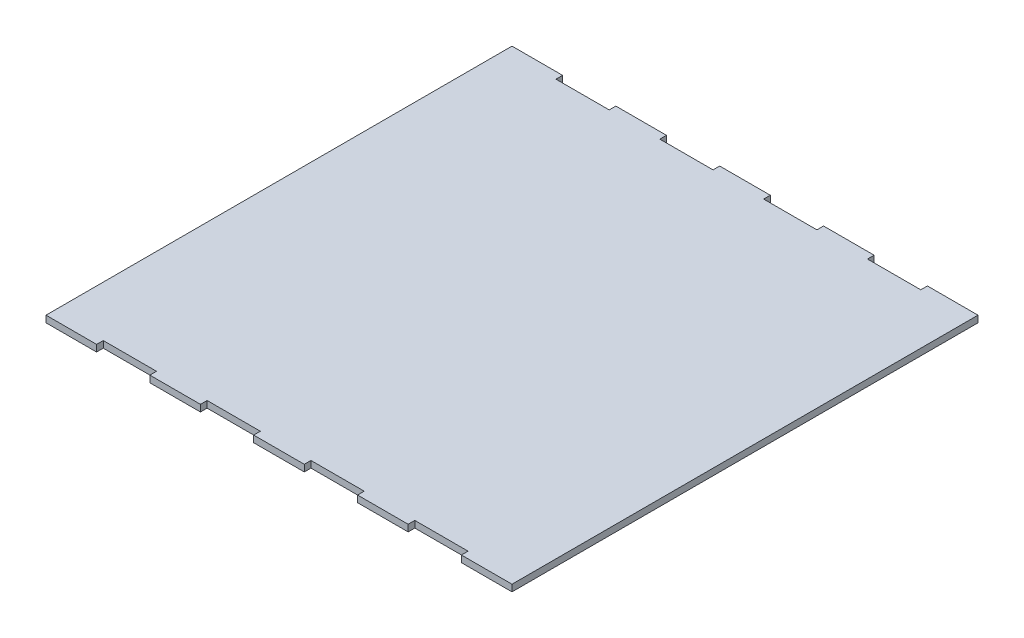
from build123d import *

# Parameters (mm, degrees)
SKIZZE1_W                       = 350
SKIZZE1_H                       = 350
GRUNDPLATTE_DEPTH               = 5
SKIZZE2_W                       = 40
SKIZZE2_H                       = 5
SCHNITT_LINEAR_AUSTRAGEN1_DEPTH = 248.53787589


with BuildPart() as part:
    # Skizze1 → Grundplatte (new body)
    with BuildSketch(Plane(origin=(0, 0, 0), x_dir=(1, 0, 0), z_dir=(0, 1, 0))):
        Rectangle(SKIZZE1_W, SKIZZE1_H)
    extrude(amount=GRUNDPLATTE_DEPTH)

    # Skizze2 → Schnitt-Linear austragen1 (cut, through all)
    with BuildSketch(Plane(origin=(0, 5, 0), x_dir=(1, 0, 0), z_dir=(0, 1, 0))):
        with Locations((-117, 172.5)):
            Rectangle(SKIZZE2_W, SKIZZE2_H)
        with Locations((-39, 172.5)):
            Rectangle(SKIZZE2_W, SKIZZE2_H)
        with Locations((39, 172.5)):
            Rectangle(SKIZZE2_W, SKIZZE2_H)
        with Locations((117, 172.5)):
            Rectangle(SKIZZE2_W, SKIZZE2_H)
    schnitt_linear_austragen1 = extrude(amount=-SCHNITT_LINEAR_AUSTRAGEN1_DEPTH, mode=Mode.SUBTRACT)

    # Spiegeln1: Schnitt-Linear austragen1 across plane
    add(schnitt_linear_austragen1.mirror(Plane.XY), mode=Mode.SUBTRACT)


solid = part.part
